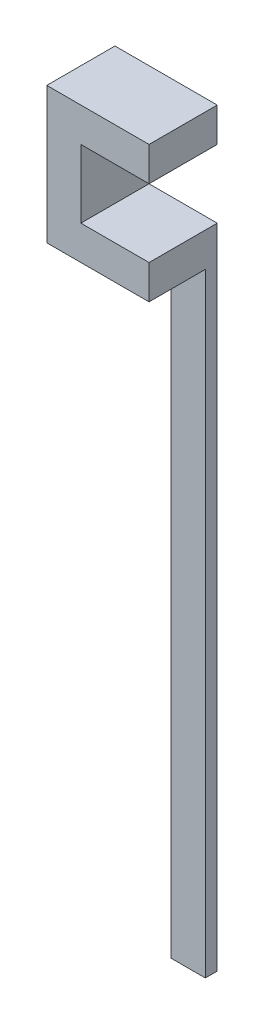
from build123d import *

# Parameters (mm, degrees)
BOSS_EXTRUDE1_DEPTH = 10
SKETCH3_W           = 5
SKETCH3_H           = 1.75
BOSS_EXTRUDE2_DEPTH = 90


with BuildPart() as part:
    # Sketch1 → Boss-Extrude1 (new body)
    with BuildSketch(Plane.XY):
        Polygon((0, 10.81190481), (0, -9.18809519), (15, -9.18809519), (15, -4.18809519), (5, -4.18809519), (5, 5.81190481), (15, 5.81190481), (15, 10.81190481), align=None)
    extrude(amount=BOSS_EXTRUDE1_DEPTH)

    # Sketch3 → Boss-Extrude2 (add)
    with BuildSketch(Plane(origin=(0, -9.18809519, 0), x_dir=(-1, 0, 0), z_dir=(0, -1, 0))):
        with Locations((-12.5, -0.875)):
            Rectangle(SKETCH3_W, SKETCH3_H)
    extrude(amount=BOSS_EXTRUDE2_DEPTH)


solid = part.part
